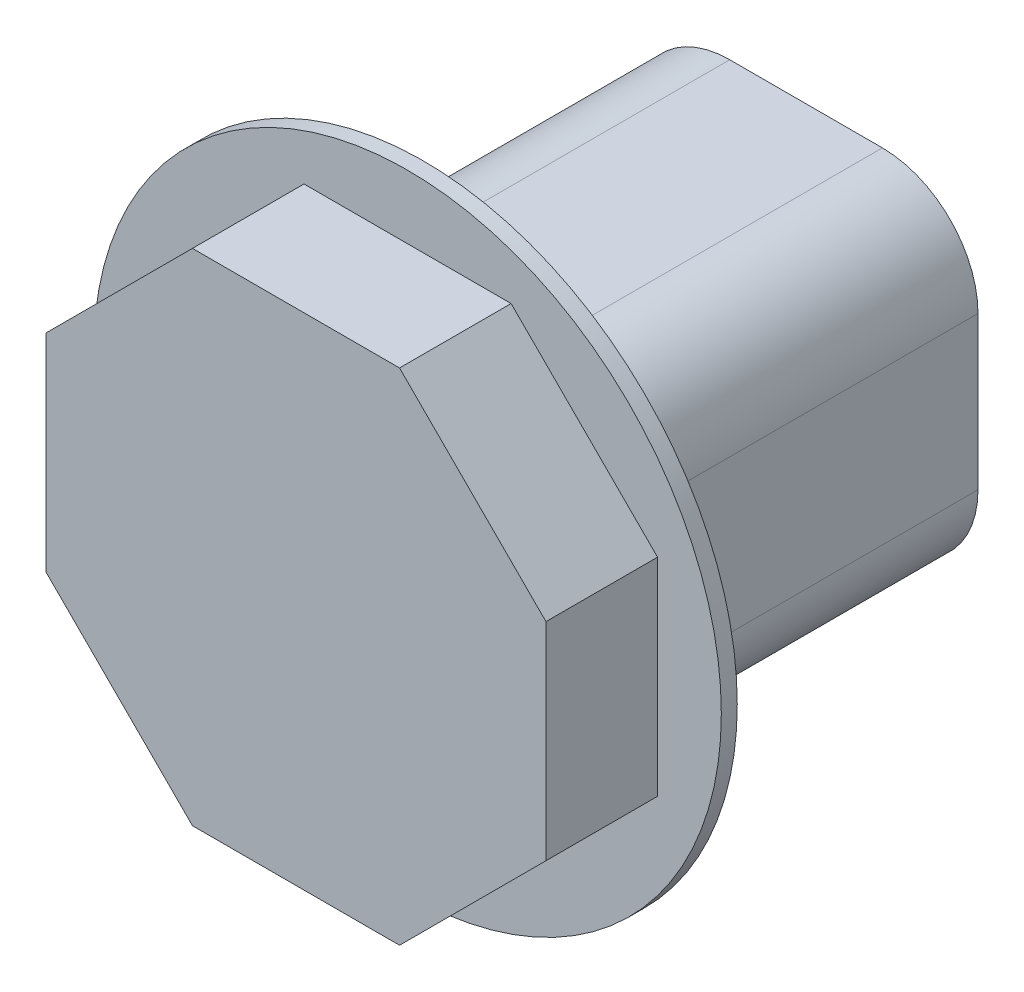
from build123d import *

# Parameters (mm, degrees)
BOSS_EXTRUDE1_DEPTH = 203.2
SKETCH1_3_R         = 500
BOSS_EXTRUDE2_DEPTH = 25.4
SKETCH2_W           = 548.008149558
SKETCH2_H           = 548.008149558
BOSS_EXTRUDE3_DEPTH = 609.6
FILLET1_R           = 152.4


with BuildPart() as part:
    # Sketch1 → Boss-Extrude1 (new body)
    with BuildSketch(Plane.XY):
        Polygon((398.358671467, 165.005564411), (165.005564411, 398.358671467), (-165.005564411, 398.358671467), (-398.358671467, 165.005564411), (-398.358671467, -165.005564411), (-165.005564411, -398.358671467), (165.005564411, -398.358671467), (398.358671467, -165.005564411), align=None)
    extrude(amount=BOSS_EXTRUDE1_DEPTH)

    # Sketch1<3> → Boss-Extrude2 (add)
    with BuildSketch(Plane.XY):
        Circle(SKETCH1_3_R)
        Polygon((165.005564411, 398.358671467), (-165.005564411, 398.358671467), (-398.358671467, 165.005564411), (-398.358671467, -165.005564411), (-165.005564411, -398.358671467), (165.005564411, -398.358671467), (398.358671467, -165.005564411), (398.358671467, 165.005564411), align=None, mode=Mode.SUBTRACT)
    extrude(amount=BOSS_EXTRUDE2_DEPTH)


with BuildPart() as body_2:
    # Sketch2 → Boss-Extrude3 (new body)
    with BuildSketch(Plane(origin=(0, 0, 0), x_dir=(-1, 0, 0), z_dir=(0, 0, -1))):
        Rectangle(SKETCH2_W, SKETCH2_H)
    extrude(amount=BOSS_EXTRUDE3_DEPTH)

    # Fillet1
    fillet1_edges = [body_2.edges().sort_by_distance(p)[0] for p in [
        (274.004074779, 274.004074779, -304.8),
        (-274.004074779, 274.004074779, -304.8),
        (-274.004074779, -274.004074779, -304.8),
        (274.004074779, -274.004074779, -304.8),
    ]]
    fillet(fillet1_edges, radius=FILLET1_R)


solid = Compound([part.part, body_2.part])
